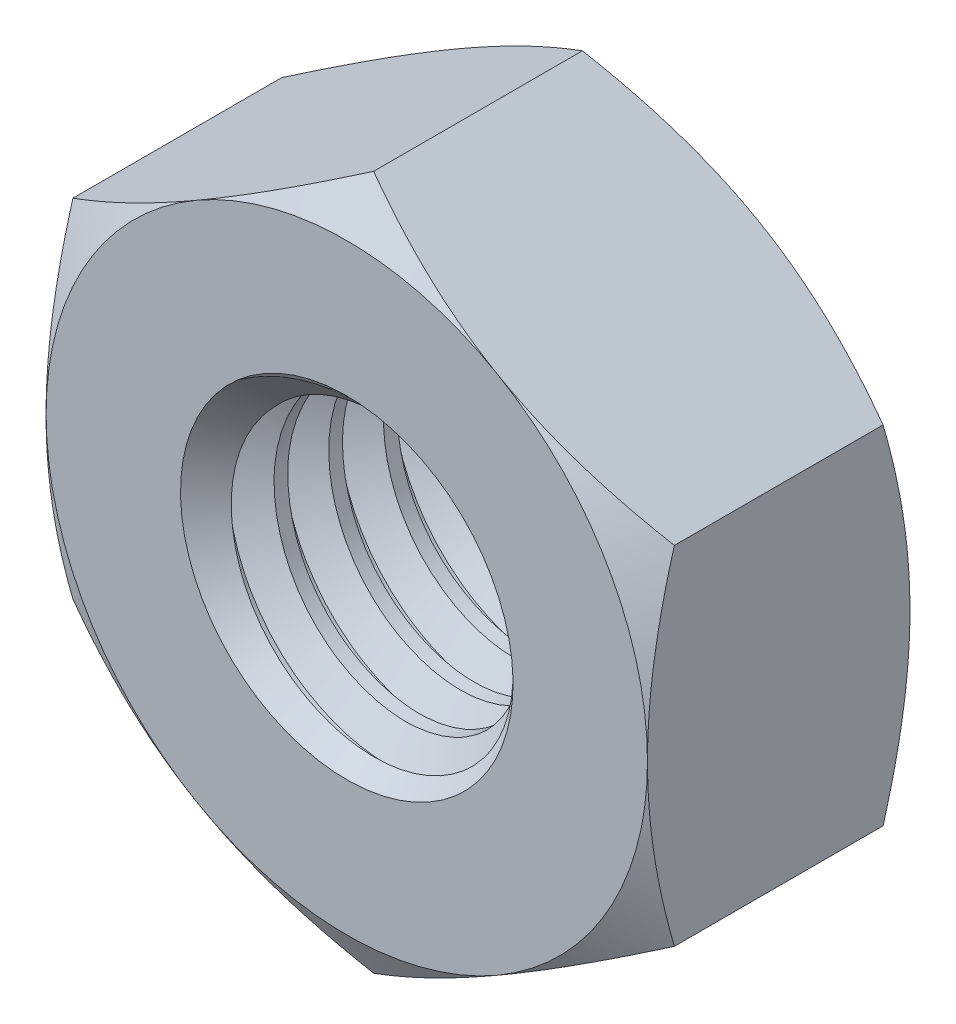
from build123d import *

# Parameters (mm, degrees)
SKETCH2_R           = 1.25
BOSS_EXTRUDE1_DEPTH = 1.2
CHAMFER1_SIZE       = 0.2705
CUT_SWEEP1_PITCH    = 0.5


with BuildPart() as part:
    # Sketch2 → Boss-Extrude1 (new, symmetric)
    with BuildSketch(Plane.XY):
        Polygon((2.75, 1.58771324), (2.75, -1.58771324), (0, -3.175426481), (-2.75, -1.58771324), (-2.75, 1.58771324), (0, 3.175426481), align=None)
        Circle(SKETCH2_R, mode=Mode.SUBTRACT)
    extrude(amount=BOSS_EXTRUDE1_DEPTH, both=True)

    # Sketch4 → Cut-Revolve2 (revolve, cut)
    with BuildSketch(Plane(origin=(0, 0, 0), x_dir=(0, 0, -1), z_dir=(1, 0, 0))):
        Polygon((1.2, 2.75), (1.2, 4.328660734), (0.2885598, 4.328660734), align=None)
    cut_revolve2 = revolve(axis=Axis((0, 0, 2.99453507), (0, 0, -1)), mode=Mode.SUBTRACT)

    # Mirror1: Cut-Revolve2 across plane
    add(cut_revolve2.mirror(Plane.XY), mode=Mode.SUBTRACT)

    # Chamfer1
    chamfer1_edges = [part.edges().sort_by_distance(p)[0] for p in [
        (-1.25, 0, -1.2),
        (-1.25, 0, 1.2),
    ]]
    chamfer(chamfer1_edges, length=CHAMFER1_SIZE)

    # Cut-Sweep1: the profile of Sketch6 screwed along a right-hand helix of 10 turns, 6 arcs to a turn; built about Z, then put on its axis
    cut_sweep1_z = Axis((0, 0, 0), (0, 0, 1))
    cut_sweep1_corners = [(1.5205, 0, 0.03125), (1.5205, 0, -0.03125), (0.962272503, 0, -0.353542796), (0.962272503, 0, 0.353542796)]
    with BuildLine(mode=Mode.PRIVATE) as cut_sweep1_profile:
        Line(cut_sweep1_corners[0], cut_sweep1_corners[1])
        Line(cut_sweep1_corners[1], cut_sweep1_corners[2])
        Line(cut_sweep1_corners[2], cut_sweep1_corners[3])
        Line(cut_sweep1_corners[3], cut_sweep1_corners[0])
    cut_sweep1_cap = Face(cut_sweep1_profile.wire())
    cut_sweep1_turn_angles = [0, 30, 60, 90, 120, 150, 180, 210, 240, 270, 300, 330, 360]
    cut_sweep1_turn_weights = [1, 0.8660254037844387, 1, 0.8660254037844387, 1, 0.8660254037844387, 1, 0.8660254037844387, 1, 0.8660254037844387, 1, 0.8660254037844387, 1]
    cut_sweep1_turn_rails = [Edge.make_bspline([Vector(p[0], p[1], 0).rotate(cut_sweep1_z, cut_sweep1_turn_angles[k]) / cut_sweep1_turn_weights[k] + Vector(0, 0, p[2] + CUT_SWEEP1_PITCH * cut_sweep1_turn_angles[k] / 360) for k in range(13)], [0, 0, 0, 1, 1, 2, 2, 3, 3, 4, 4, 5, 5, 6, 6, 6], 2, cut_sweep1_turn_weights) for p in cut_sweep1_corners]
    cut_sweep1_turn_sides = [Face.make_surface_from_curves(cut_sweep1_turn_rails[p[0]], cut_sweep1_turn_rails[p[1]]) for p in [(0, 1), (1, 2), (2, 3), (3, 0)]]
    cut_sweep1 = Plane(origin=(0, 0, -1.7), x_dir=(-1, 0, 0), z_dir=(0, 0, 1)) * Solid(Shell([*[p.moved(Location((0, 0, CUT_SWEEP1_PITCH * i))) for i in range(10) for p in cut_sweep1_turn_sides], cut_sweep1_cap, cut_sweep1_cap.rotate(cut_sweep1_z, 3600).moved(Location((0, 0, CUT_SWEEP1_PITCH * 3600 / 360)))]))
    add(cut_sweep1, mode=Mode.SUBTRACT)


solid = part.part
